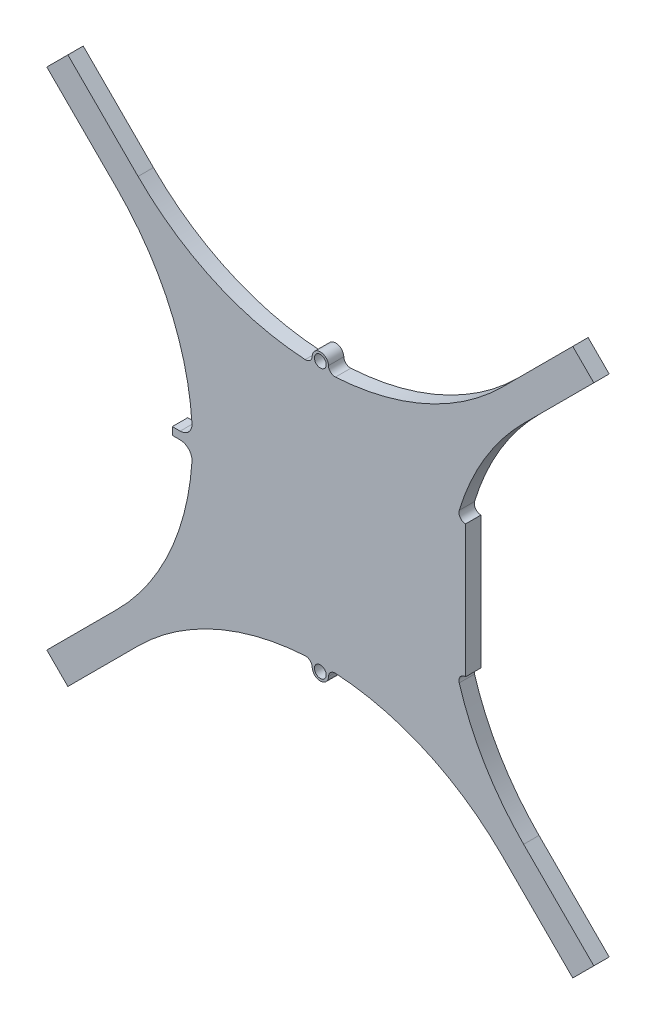
from build123d import *

# Parameters (mm, degrees)
SKETCH1_R           = 0.634780864
BOSS_EXTRUDE1_DEPTH = 1.65
FILLET1_R           = 0.7112
FILLET2_R           = 0.7112
FILLET3_R           = 1.27


with BuildPart() as part:
    # Sketch1 → Boss-Extrude1 (new body)
    with BuildSketch(Plane.XY):
        with BuildLine():
            Line((-27.135222714, 29.397964527), (-29.397964527, 27.135222714))
            Line((-29.397964527, 27.135222714), (-21.855060774, 19.592318961))
            ThreePointArc((-21.855060774, 19.592318961), (-15.928204538, 10.7930358), (-13.742710724, 0.41138729))
            Line((-13.742710724, 0.41138729), (-15.908512943, 0.41138729))
            Line((-15.908512943, 0.41138729), (-15.908512943, -0.41138729))
            Line((-15.908512943, -0.41138729), (-13.742710724, -0.41138729))
            ThreePointArc((-13.742710724, -0.41138729), (-15.928204538, -10.7930358), (-21.855060774, -19.592318961))
            Line((-21.855060774, -19.592318961), (-29.397964527, -27.135222714))
            Line((-29.397964527, -27.135222714), (-27.135222714, -29.397964527))
            Line((-27.135222714, -29.397964527), (-19.592318961, -21.855060774))
            ThreePointArc((-19.592318961, -21.855060774), (-10.842511416, -15.949186255), (-0.51885361, -13.744514983))
            ThreePointArc((-0.51885361, -13.744514983), (0, -15.324082887), (0.51885361, -13.744514983))
            ThreePointArc((0.51885361, -13.744514983), (10.842511416, -15.949186255), (19.592318961, -21.855060774))
            Line((19.592318961, -21.855060774), (27.135222714, -29.397964527))
            Line((27.135222714, -29.397964527), (29.397964527, -27.135222714))
            Line((29.397964527, -27.135222714), (21.855060774, -19.592318961))
            ThreePointArc((21.855060774, -19.592318961), (17.437236913, -13.828628501), (14.668755804, -7.114999994))
            Line((14.668755804, -7.114999994), (15.618947426, -7.114999994))
            Line((15.618947426, -7.114999994), (15.618947426, 7.114999994))
            Line((15.618947426, 7.114999994), (14.668755804, 7.114999994))
            ThreePointArc((14.668755804, 7.114999994), (17.437236913, 13.828628501), (21.855060774, 19.592318961))
            Line((21.855060774, 19.592318961), (29.397964527, 27.135222714))
            Line((29.397964527, 27.135222714), (27.135222714, 29.397964527))
            Line((27.135222714, 29.397964527), (19.592318961, 21.855060774))
            ThreePointArc((19.592318961, 21.855060774), (10.842511416, 15.949186255), (0.51885361, 13.744514983))
            ThreePointArc((0.51885361, 13.744514983), (0, 15.324082887), (-0.51885361, 13.744514983))
            ThreePointArc((-0.51885361, 13.744514983), (-10.842511416, 15.949186255), (-19.592318961, 21.855060774))
            Line((-19.592318961, 21.855060774), (-27.135222714, 29.397964527))
        make_face()
        with Locations((0, 14.449082887)):
            Circle(SKETCH1_R, mode=Mode.SUBTRACT)
        with Locations((0, -14.449082887)):
            Circle(SKETCH1_R, mode=Mode.SUBTRACT)
    extrude(amount=BOSS_EXTRUDE1_DEPTH)

    # Fillet1
    fillet1_edges = [part.edges().sort_by_distance(p)[0] for p in [
        (-0.51885361, -13.744514983, 0.825),
        (0.51885361, -13.744514983, 0.825),
        (-0.51885361, 13.744514983, 0.825),
        (0.51885361, 13.744514983, 0.825),
    ]]
    fillet(fillet1_edges, radius=FILLET1_R)

    # Fillet2
    fillet2_edges = [part.edges().sort_by_distance(p)[0] for p in [
        (14.668755804, -7.114999994, 0.825),
        (14.668755804, 7.114999994, 0.825),
    ]]
    fillet(fillet2_edges, radius=FILLET2_R)

    # Fillet3
    fillet3_edges = [part.edges().sort_by_distance(p)[0] for p in [
        (-13.742710724, 0.41138729, 0.825),
        (-13.742710724, -0.41138729, 0.825),
    ]]
    fillet(fillet3_edges, radius=FILLET3_R)


solid = part.part
